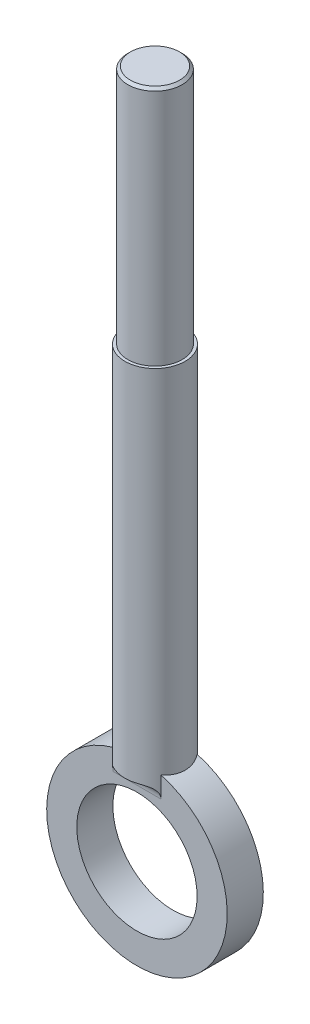
from build123d import *

# Parameters (mm, degrees)
SKETCH1_R                = 2.5
BOSS_EXTRUDE1_DEPTH      = 50
BOSS_EXTRUDE2_DEPTH      = 1.5
BOSS_EXTRUDE2_DEPTH_BACK = 1.5
SKETCH2_R                = 7.5
SKETCH2_R_2              = 5
FILLET1_R                = 1
FILLET2_R                = 1


# Read off the part's stored shape, not the designer's step: M5x0.75 Machine Threads Stud1
with BuildPart() as part:
    # Sketch1 → Boss-Extrude1 (new body)
    with BuildSketch(Plane(origin=(0, 0, 0), x_dir=(1, 0, 0), z_dir=(0, 1, 0))):
        with Locations(Location((0, 0, 0), (0, 0, 270))):
            Circle(SKETCH1_R)
    extrude(amount=BOSS_EXTRUDE1_DEPTH)

    # Sketch2 → Boss-Extrude2 (add, two sides: drawn at the far end of the back side and taken through both)
    with BuildSketch(Plane.XY.offset(-BOSS_EXTRUDE2_DEPTH_BACK)):
        with Locations((0, -6.5)):
            Circle(SKETCH2_R)
        with Locations((0, -6.5)):
            Circle(SKETCH2_R_2, mode=Mode.SUBTRACT)
    extrude(amount=BOSS_EXTRUDE2_DEPTH + BOSS_EXTRUDE2_DEPTH_BACK)

    # Fillet1
    fillet1_edges = [part.edges().sort_by_distance(p)[0] for p in [
        (0, 0, -1.5),
    ]]
    fillet(fillet1_edges, radius=FILLET1_R - 0.0001)  # a hair under: the kernel refuses the full size

    # Fillet2
    fillet2_edges = [part.edges().sort_by_distance(p)[0] for p in [
        (0, 0, 1.5),
    ]]
    fillet(fillet2_edges, radius=FILLET2_R - 0.0001)  # a hair under: the kernel refuses the full size

    # M5x0.75 Machine Threads Stud1 outline → M5x0.75 Machine Threads Stud1 (revolve, cut)
    with BuildSketch(Plane.XY):
        Polygon((2.5, 50), (2.04, 50), (2.2565, 49.7835), (2.2565, 30), (2.5, 30), align=None)
    revolve(axis=Axis((0, 0, 0), (0, 1, 0)), mode=Mode.SUBTRACT)


solid = part.part
